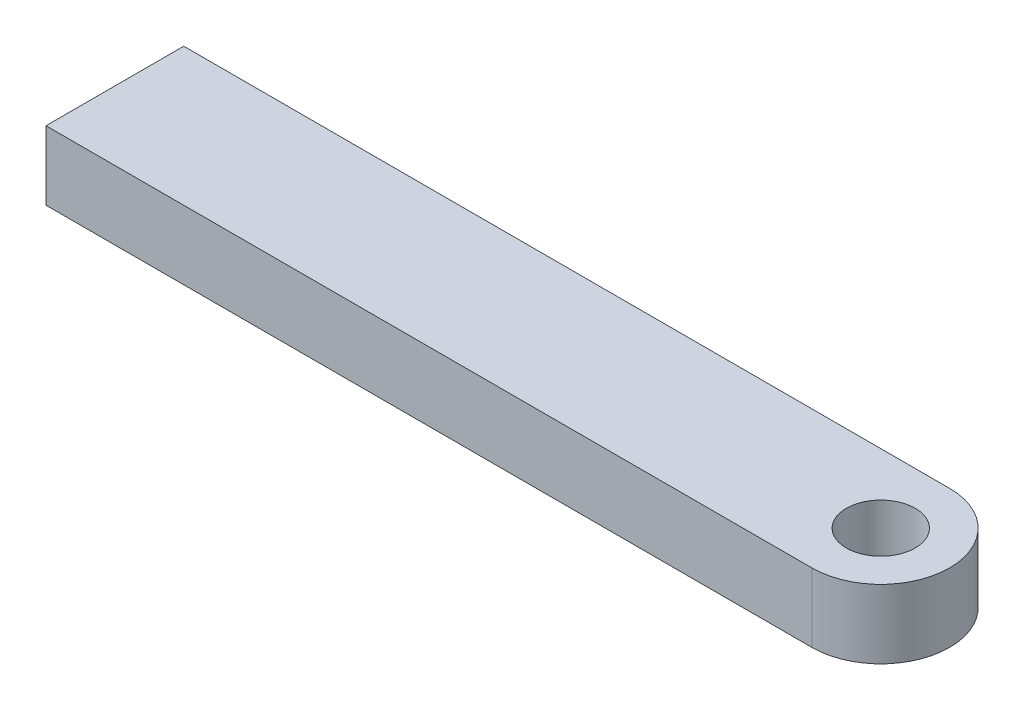
from build123d import *

# Parameters (mm, degrees)
ESQUISSE1_R                     = 2.5
BOSS_EXTRU_1_DEPTH              = 2.5
TROU_TARAUD_M3X0_51_D           = 2.5
TROU_TARAUD_M3X0_51_DEPTH       = 12.5
TROU_TARAUD_M3X0_51_CSINK_D     = 3.05
TROU_TARAUD_M3X0_51_CSINK_ANGLE = 90
TROU_TARAUD_M3X0_51_TIP         = 0.751075774


with BuildPart() as part:
    # Esquisse1 → Boss.-Extru.1 (new, symmetric)
    with BuildSketch(Plane(origin=(0, 0, 0), x_dir=(1, 0, 0), z_dir=(0, 1, 0))):
        with BuildLine():
            Line((-55.6, -5), (0, -5))
            ThreePointArc((0, -5), (5, 0), (0, 5))
            Line((0, 5), (-55.6, 5))
            Line((-55.6, 5), (-55.6, -5))
        make_face()
        Circle(ESQUISSE1_R, mode=Mode.SUBTRACT)
    extrude(amount=BOSS_EXTRU_1_DEPTH, both=True)

    # Trou taraudé M3x0.51
    with Locations(Plane.ZY.offset(55.6)):
        with Locations((0, -0.25)):
            CounterSinkHole(TROU_TARAUD_M3X0_51_D / 2, TROU_TARAUD_M3X0_51_CSINK_D / 2, depth=TROU_TARAUD_M3X0_51_DEPTH, counter_sink_angle=TROU_TARAUD_M3X0_51_CSINK_ANGLE)
            with Locations((0, 0, -(TROU_TARAUD_M3X0_51_DEPTH + TROU_TARAUD_M3X0_51_TIP / 2))):  # 118° drill point
                Cone(0, TROU_TARAUD_M3X0_51_D / 2, TROU_TARAUD_M3X0_51_TIP, mode=Mode.SUBTRACT)


solid = part.part
